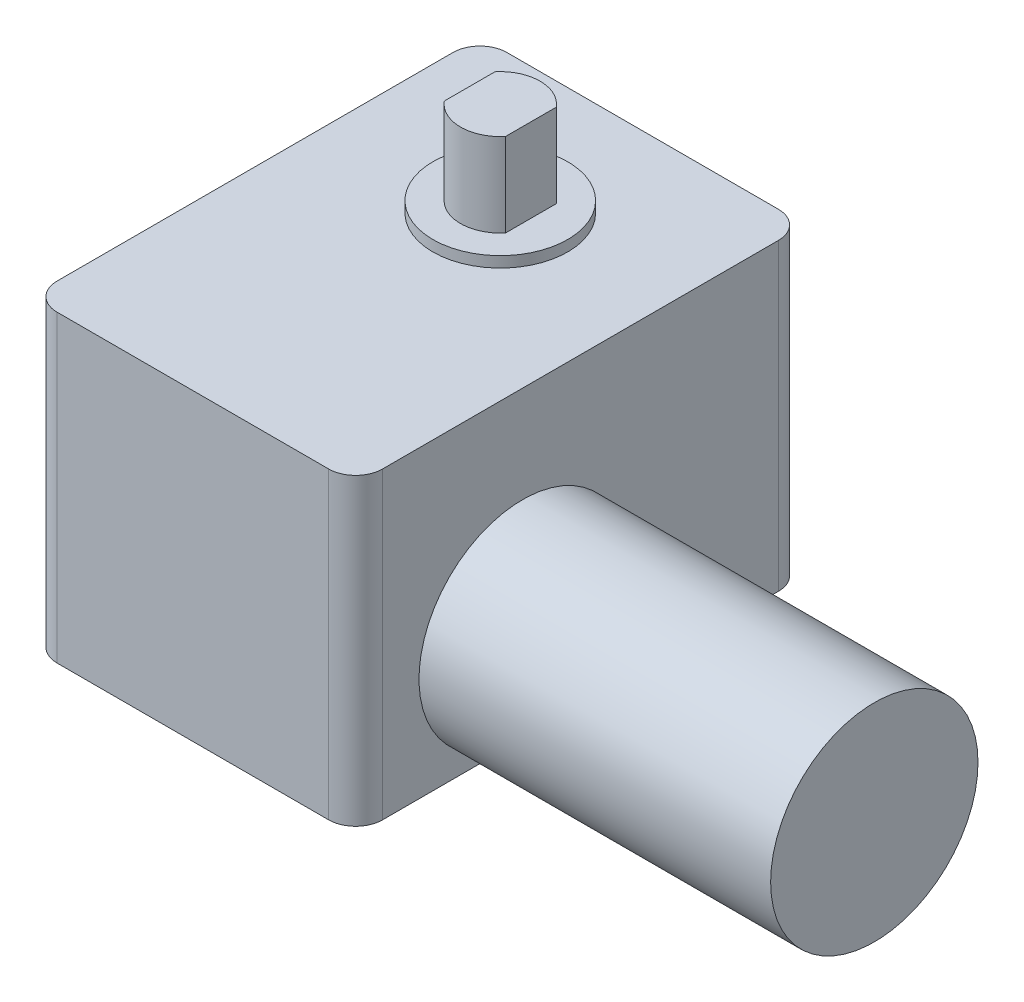
from build123d import *

# Parameters (mm, degrees)
SKETCH2_W           = 13.04
SKETCH2_H           = 3.845
SKETCH2_5_W         = 12.07
SKETCH2_5_H         = 16.68
BOSS_EXTRUDE1_DEPTH = 3.845
SKETCH2_6_R         = 2.5
BOSS_EXTRUDE2_DEPTH = 7.425
SKETCH2_7_R         = 2.5
BOSS_EXTRUDE3_DEPTH = 7.825
BOSS_EXTRUDE4_DEPTH = 10.925
FILLET1_R           = 1


with BuildPart() as part:
    # Sketch2 → Revolve1 (revolve)
    with BuildSketch(Plane(origin=(0, 0, 0), x_dir=(1, 0, 0), z_dir=(0, 1, 0))):
        with Locations((18.59, 4.2725)):
            Rectangle(SKETCH2_W, SKETCH2_H)
    revolve(axis=Axis((25.11, 0, -6.195), (-1, 0, 0)))

    # Sketch2<5> → Boss-Extrude1 (add)
    with BuildSketch(Plane(origin=(0, 0, 0), x_dir=(1, 0, 0), z_dir=(0, 1, 0))):
        with Locations((6.035, 8.34)):
            Rectangle(SKETCH2_5_W, SKETCH2_5_H)
    extrude(amount=-BOSS_EXTRUDE1_DEPTH)

    # Sketch2<6> → Boss-Extrude2 (add)
    with BuildSketch(Plane(origin=(0, 0, 0), x_dir=(1, 0, 0), z_dir=(0, 1, 0))):
        Polygon((0, 16.68), (0, 0), (12.07, 0), (12.07, 2.35), (12.07, 6.195), (12.07, 10.04), (12.07, 16.68), align=None)
        with Locations((6.035, 11.4)):
            Circle(SKETCH2_6_R, mode=Mode.SUBTRACT)
    extrude(amount=BOSS_EXTRUDE2_DEPTH)

    # Sketch2<7> → Boss-Extrude3 (add)
    with BuildSketch(Plane(origin=(0, 0, 0), x_dir=(1, 0, 0), z_dir=(0, 1, 0))):
        with Locations((6.035, 11.4)):
            Circle(SKETCH2_7_R)
        with BuildLine():
            Line((4.898327224, 10.46), (4.898327224, 12.34))
            ThreePointArc((4.898327224, 12.34), (6.035, 12.875), (7.171672776, 12.34))
            Line((7.171672776, 12.34), (7.171672776, 10.46))
            ThreePointArc((7.171672776, 10.46), (6.035, 9.925), (4.898327224, 10.46))
        make_face(mode=Mode.SUBTRACT)
    extrude(amount=BOSS_EXTRUDE3_DEPTH)

    # Sketch2<8> → Boss-Extrude4 (add)
    with BuildSketch(Plane(origin=(0, 0, 0), x_dir=(1, 0, 0), z_dir=(0, 1, 0))):
        with BuildLine():
            ThreePointArc((7.171672776, 12.34), (6.035, 12.875), (4.898327224, 12.34))
            Line((4.898327224, 12.34), (4.898327224, 10.46))
            ThreePointArc((4.898327224, 10.46), (6.035, 9.925), (7.171672776, 10.46))
            Line((7.171672776, 10.46), (7.171672776, 12.34))
        make_face()
    extrude(amount=BOSS_EXTRUDE4_DEPTH)

    # Fillet1
    fillet1_edges = [part.edges().sort_by_distance(p)[0] for p in [
        (0, 1.79, 0),
        (12.07, 1.79, 0),
        (12.07, 1.79, -16.68),
        (0, 1.79, -16.68),
    ]]
    fillet(fillet1_edges, radius=FILLET1_R)


solid = part.part
